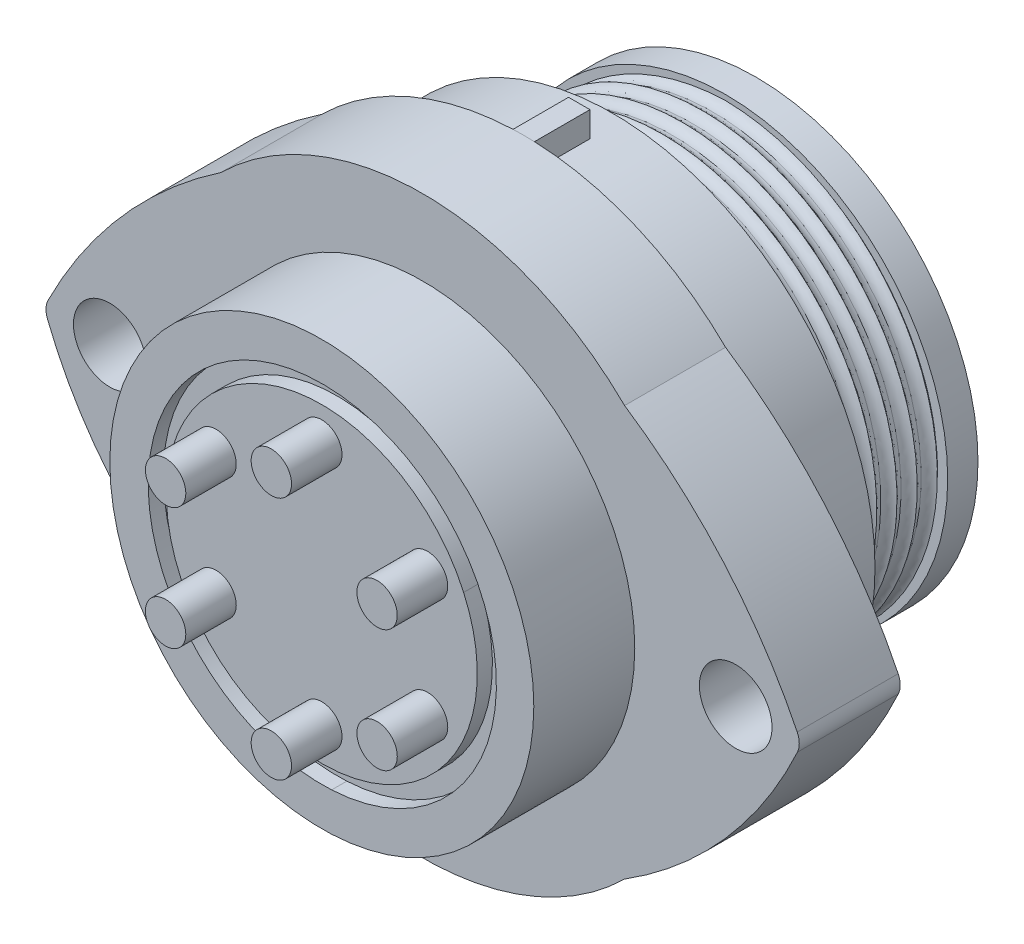
from build123d import *

# Parameters (mm, degrees)
SKETCH1_R            = 10.5
BOSS_EXTRUDE1_DEPTH  = 5
BOSS_EXTRUDE2_DEPTH  = 5
SKETCH3_R            = 1.8
CUT_EXTRUDE1_DEPTH   = 5
FILLET1_R            = 1
SKETCH6_R            = 1
BOSS_EXTRUDE6_DEPTH  = 2.5
CIRPATTERN2_COUNT    = 6
SKETCH7_R            = 13
BOSS_EXTRUDE7_DEPTH  = 4.4
SKETCH8_R            = 11
BOSS_EXTRUDE8_DEPTH  = 5.6
CUT_SWEEP1_PITCH     = 1
CUT_SWEEP1_TO        = 5.6
SKETCH14_R           = 11
BOSS_EXTRUDE9_DEPTH  = 1.5
SKETCH15_R           = 9.5
CUT_EXTRUDE2_DEPTH   = 3.5
SKETCH16_R           = 6.15
BOSS_EXTRUDE10_DEPTH = 5
SKETCH17_R           = 1
CUT_EXTRUDE3_DEPTH   = 3
CIRPATTERN3_COUNT    = 6
SKETCH18_W           = 1.059537874
SKETCH18_H           = 1.27
BOSS_EXTRUDE11_DEPTH = 2.75
CUT_EXTRUDE6_DEPTH   = 0.75


with BuildPart() as part:
    # Sketch1 → Boss-Extrude1 (new body)
    with BuildSketch(Plane.XY):
        Circle(SKETCH1_R)
    extrude(amount=BOSS_EXTRUDE1_DEPTH)

    # Sketch2 → Boss-Extrude2 (add)
    with BuildSketch(Plane.XY):
        with BuildLine():
            ThreePointArc((9.997356942, 10.154573067), (0, 14.25), (-9.997356942, 10.154573067))
            ThreePointArc((-9.997356942, 10.154573067), (-15.049933785, 5.660178727), (-18.75, 0))
            ThreePointArc((-18.75, 0), (-15.295779894, -5.872083573), (-9.997356942, -10.154573067))
            ThreePointArc((-9.997356942, -10.154573067), (0, -14.25), (9.997356942, -10.154573067))
            ThreePointArc((9.997356942, -10.154573067), (15.140826904, -5.738523236), (18.75, 0))
            ThreePointArc((18.75, 0), (15.074492991, 5.681347314), (9.997356942, 10.154573067))
        make_face()
    extrude(amount=-BOSS_EXTRUDE2_DEPTH)

    # Sketch3 → Cut-Extrude1 (cut)
    with BuildSketch(Plane(origin=(0, 0, -5), x_dir=(-1, 0, 0), z_dir=(0, 0, -1))):
        with Locations((-15.5, 0)):
            Circle(SKETCH3_R)
        with Locations((15.5, 0)):
            Circle(SKETCH3_R)
    extrude(amount=-CUT_EXTRUDE1_DEPTH, mode=Mode.SUBTRACT)

    # Fillet1
    fillet1_edges = [part.edges().sort_by_distance(p)[0] for p in [
        (-18.75, 0, -2.5),
        (18.75, 0, -2.5),
    ]]
    fillet(fillet1_edges, radius=FILLET1_R)

    # Sketch6 → Boss-Extrude6 (add)
    with BuildSketch(Plane.XY.offset(5)):
        with Locations((0, 6.047591454)):
            Circle(SKETCH6_R)
    boss_extrude6 = extrude(amount=BOSS_EXTRUDE6_DEPTH)

    # CirPattern2: Boss-Extrude6 ×6 about axis
    cirpattern2_axis = Axis((0, 0, 0), (0, 0, 1))
    for i in range(1, CIRPATTERN2_COUNT):
        add(boss_extrude6.rotate(cirpattern2_axis, i * 360 / CIRPATTERN2_COUNT))

    # Sketch7 → Boss-Extrude7 (add)
    with BuildSketch(Plane(origin=(0, 0, -5), x_dir=(-1, 0, 0), z_dir=(0, 0, -1))):
        with Locations(Location((0, 0, 0), (0, 0, 180))):
            Circle(SKETCH7_R)
    extrude(amount=BOSS_EXTRUDE7_DEPTH)

    # Sketch8 → Boss-Extrude8 (add)
    with BuildSketch(Plane(origin=(0, 0, -9.4), x_dir=(-1, 0, 0), z_dir=(0, 0, -1))):
        Circle(SKETCH8_R)
    extrude(amount=BOSS_EXTRUDE8_DEPTH)

    # Cut-Sweep1: arcs per turn and ends read off the stored shape
    # Cut-Sweep1: the profile of Sketch13 screwed along a left-hand helix through 8 turns, 8 arcs to a turn; built about Z, then put on its axis
    cut_sweep1_z = Axis((0, 0, 0), (0, 0, 1))
    cut_sweep1_corners = [(11, 0, -1.56491125), (10.43508875, 0, -1), (11, 0, -0.43508875), (11.56491125, 0, -1)]
    with BuildLine(mode=Mode.PRIVATE) as cut_sweep1_profile:
        ThreePointArc((11, 0, -1.56491125), (10.600547424, 0, -1.399452576), (10.43508875, 0, -1))
        ThreePointArc((10.43508875, 0, -1), (10.600547424, 0, -0.600547424), (11, 0, -0.43508875))
        ThreePointArc((11, 0, -0.43508875), (11.399452576, 0, -0.600547424), (11.56491125, 0, -1))
        ThreePointArc((11.56491125, 0, -1), (11.399452576, 0, -1.399452576), (11, 0, -1.56491125))
    cut_sweep1_cap = Face(cut_sweep1_profile.wire())
    cut_sweep1_arcs = [((11, 0, -1.56491125), (10.43508875, 0, -1.56491125), (10.43508875, 0, -1), (1, 0.7071067811865476, 1)), ((10.43508875, 0, -1), (10.43508875, 0, -0.43508875), (11, 0, -0.43508875), (1, 0.7071067811865476, 1)), ((11, 0, -0.43508875), (11.56491125, 0, -0.43508875), (11.56491125, 0, -1), (1, 0.7071067811865476, 1)), ((11.56491125, 0, -1), (11.56491125, 0, -1.56491125), (11, 0, -1.56491125), (1, 0.7071067811865476, 1))]  # start, shoulder, end, weights
    cut_sweep1_turn_angles = [0, -22.5, -45, -67.5, -90, -112.5, -135, -157.5, -180, -202.5, -225, -247.5, -270, -292.5, -315, -337.5, -360]
    cut_sweep1_turn_weights = [1, 0.9238795325112867, 1, 0.9238795325112867, 1, 0.9238795325112867, 1, 0.9238795325112867, 1, 0.9238795325112867, 1, 0.9238795325112867, 1, 0.9238795325112867, 1, 0.9238795325112867, 1]
    cut_sweep1_turn_sides = [Face.make_bezier_surface([[Vector(p[j][0], p[j][1], 0).rotate(cut_sweep1_z, cut_sweep1_turn_angles[2 * i + k]) / cut_sweep1_turn_weights[2 * i + k] + Vector(0, 0, p[j][2] + -CUT_SWEEP1_PITCH * cut_sweep1_turn_angles[2 * i + k] / 360) for k in range(3)] for j in range(3)], [[p[3][j] * cut_sweep1_turn_weights[2 * i + k] for k in range(3)] for j in range(3)]) for p in cut_sweep1_arcs for i in range(8)]
    cut_sweep1_turn = Solid(Shell([*cut_sweep1_turn_sides, cut_sweep1_cap, cut_sweep1_cap.rotate(cut_sweep1_z, -360).moved(Location((0, 0, -CUT_SWEEP1_PITCH * -360 / 360)))]))
    cut_sweep1_each = [*[cut_sweep1_turn.moved(Location((0, 0, CUT_SWEEP1_PITCH * i))) for i in range(8)]]
    add(Plane(origin=(0, 0, -15), x_dir=(0, -1, 0), z_dir=(0, 0, 1)) * split(Compound([cut_sweep1_each[i] for i in range(0, 8, 2)]), bisect_by=Plane.XY.offset(CUT_SWEEP1_TO), keep=Keep.BOTTOM, mode=Mode.PRIVATE), mode=Mode.SUBTRACT)
    add(Plane(origin=(0, 0, -15), x_dir=(0, -1, 0), z_dir=(0, 0, 1)) * split(Compound([cut_sweep1_each[i] for i in range(1, 8, 2)]), bisect_by=Plane.XY.offset(CUT_SWEEP1_TO), keep=Keep.BOTTOM, mode=Mode.PRIVATE), mode=Mode.SUBTRACT)

    # Sketch14 → Boss-Extrude9 (add)
    with BuildSketch(Plane(origin=(0, 0, -15), x_dir=(-1, 0, 0), z_dir=(0, 0, -1))):
        Circle(SKETCH14_R)
    extrude(amount=BOSS_EXTRUDE9_DEPTH)

    # Sketch15 → Cut-Extrude2 (cut)
    with BuildSketch(Plane(origin=(0, 0, -16.5), x_dir=(-1, 0, 0), z_dir=(0, 0, -1))):
        Circle(SKETCH15_R)
    extrude(amount=-CUT_EXTRUDE2_DEPTH, mode=Mode.SUBTRACT)

    # Sketch16 → Boss-Extrude10 (add)
    with BuildSketch(Plane(origin=(0, 0, -13), x_dir=(-1, 0, 0), z_dir=(0, 0, -1))):
        Circle(SKETCH16_R)
    extrude(amount=BOSS_EXTRUDE10_DEPTH)

    # Sketch17 → Cut-Extrude3 (cut)
    with BuildSketch(Plane(origin=(0, 0, -18), x_dir=(-1, 0, 0), z_dir=(0, 0, -1))):
        with Locations((0, 3.43)):
            Circle(SKETCH17_R)
    cut_extrude3 = extrude(amount=-CUT_EXTRUDE3_DEPTH, mode=Mode.SUBTRACT)

    # CirPattern3: Cut-Extrude3 ×6 about axis
    cirpattern3_axis = Axis((0, 0, 0), (0, 0, 1))
    for i in range(1, CIRPATTERN3_COUNT):
        add(cut_extrude3.rotate(cirpattern3_axis, i * 360 / CIRPATTERN3_COUNT), mode=Mode.SUBTRACT)

    # Sketch18 → Boss-Extrude11 (add)
    with BuildSketch(Plane(origin=(0, 0, -5), x_dir=(-1, 0, 0), z_dir=(0, 0, -1))):
        with Locations((0, 13.605149047)):
            Rectangle(SKETCH18_W, SKETCH18_H)
    extrude(amount=BOSS_EXTRUDE11_DEPTH)

    # Sketch24 → Cut-Extrude6 (cut)
    with BuildSketch(Plane.XY.offset(5)):
        with BuildLine():
            ThreePointArc((-0.74642073, 8.567546679), (-6.428977344, 5.712114347), (-8.595854871, -0.266981341))
            ThreePointArc((-8.595854871, -0.266981341), (-5.807807312, -6.340999235), (0.487735916, -8.584442577))
            ThreePointArc((0.487735916, -8.584442577), (6.362076156, -5.834326565), (8.644619051, 0.237000247))
            ThreePointArc((8.644619051, 0.237000247), (5.75477121, 6.43781077), (-0.74642073, 8.567546679))
        make_face()
        with BuildLine():
            ThreePointArc((-7.696291446, -0.238951817), (-7.49612092, -1.760162251), (-6.998311859, -3.211484256))
            ThreePointArc((-6.998311859, -3.211484256), (-0.779335334, -7.660459284), (6.208185548, -4.555044699))
            ThreePointArc((6.208185548, -4.555044699), (7.657579625, -0.81073458), (7.025043628, 3.154173952))
            ThreePointArc((7.025043628, 3.154173952), (-1.729484835, 7.504983058), (-7.696291446, -0.238951817))
        make_face(mode=Mode.SUBTRACT)
    extrude(amount=-CUT_EXTRUDE6_DEPTH, mode=Mode.SUBTRACT)


solid = part.part
